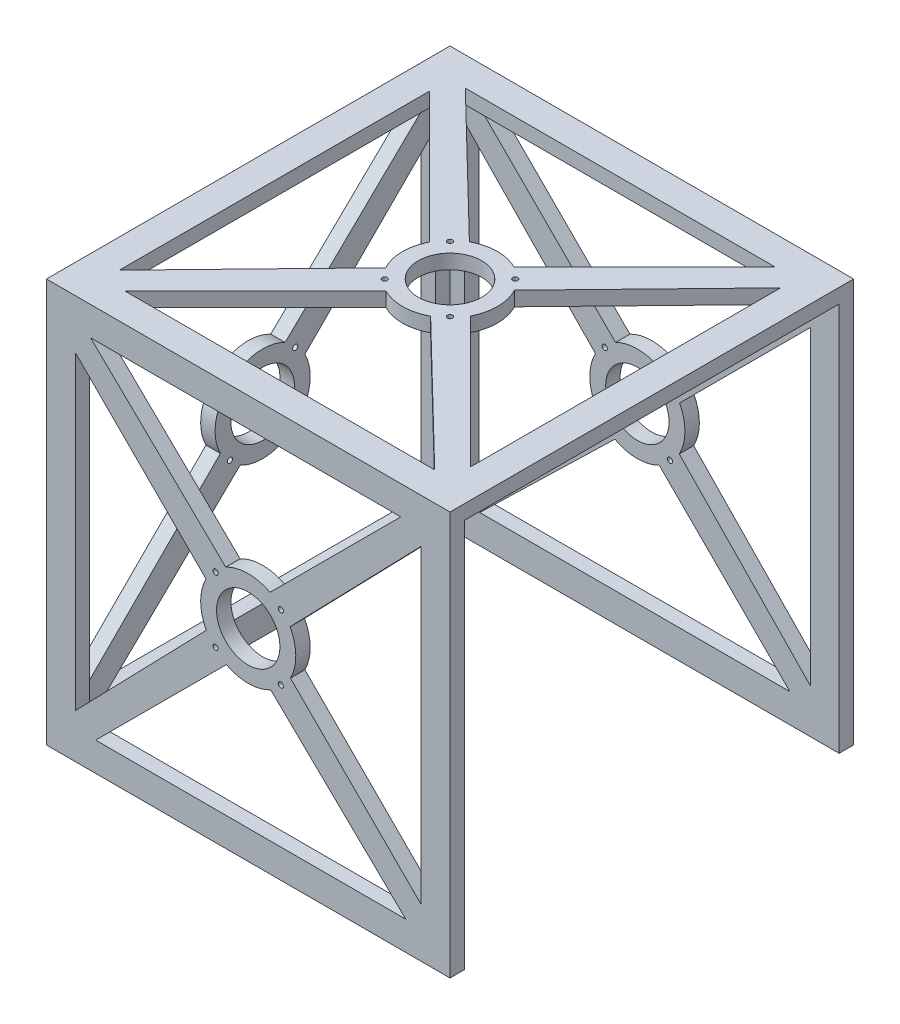
from build123d import *

# Parameters (mm, degrees)
SKETCH3_W                 = 140
SKETCH3_H                 = 140
BOSS_EXTRUDE1_DEPTH       = 5
CUT_EXTRUDE1_DEPTH        = 5
CIRPATTERN1_COUNT         = 4
CUT_EXTRUDE2_REACH        = 101.121
SKETCH7_R                 = 11
CIRPATTERN2_COUNT         = 4
CIRPATTERN3_START         = -70
CIRPATTERN3_OUTLINE_W     = 140
CIRPATTERN3_OUTLINE_H     = 140
CIRPATTERN3_OUTLINE_R     = 0.9
CIRPATTERN3_OUTLINE_R_2   = 11
CIRPATTERN3_DEPTH         = 5
CIRPATTERN3_START_2       = -135
CIRPATTERN3_2_OUTLINE_W   = 140
CIRPATTERN3_2_OUTLINE_H   = 140
CIRPATTERN3_2_OUTLINE_R   = 0.9
CIRPATTERN3_2_OUTLINE_R_2 = 11
CIRPATTERN3_2_DEPTH       = 5
CIRPATTERN4_START         = 65
CIRPATTERN4_OUTLINE_W     = 140
CIRPATTERN4_OUTLINE_H     = 140
CIRPATTERN4_OUTLINE_R     = 0.9
CIRPATTERN4_OUTLINE_R_2   = 11
CIRPATTERN4_DEPTH         = 5


# Read off the part's stored shape, not the designer's step: CirPattern3, CirPattern4
with BuildPart() as part:
    # Sketch3 → Boss-Extrude1 (new body)
    with BuildSketch(Plane.XY):
        Rectangle(SKETCH3_W, SKETCH3_H)
    extrude(amount=BOSS_EXTRUDE1_DEPTH)

    # Sketch4 → Cut-Extrude1 (cut)
    with BuildSketch(Plane.XY.offset(5)):
        with BuildLine():
            Line((7.583144073, 14.654211885), (52.928932188, 60))
            Line((52.928932188, 60), (-54.688394727, 60))
            Line((-54.688394727, 60), (-7.80758307, 14.53587447))
            ThreePointArc((-7.80758307, 14.53587447), (-0.126862728, 16.499512291), (7.583144073, 14.654211885))
        make_face()
    cut_extrude1 = extrude(amount=-CUT_EXTRUDE1_DEPTH, mode=Mode.SUBTRACT)

    # CirPattern1: Cut-Extrude1 ×4 about axis
    cirpattern1_axis = Axis((0, 0, 0), (0, 0, 1))
    for i in range(1, CIRPATTERN1_COUNT):
        add(cut_extrude1.rotate(cirpattern1_axis, i * 360 / CIRPATTERN1_COUNT), mode=Mode.SUBTRACT)

    # Sketch7 → Cut-Extrude2 (cut, up to next)
    with BuildSketch(Plane.XY.offset(5), mode=Mode.PRIVATE) as cut_extrude2_sk1:
        Circle(SKETCH7_R)
    cut_extrude2_tool1 = extrude(cut_extrude2_sk1.sketch, amount=-CUT_EXTRUDE2_REACH, mode=Mode.PRIVATE) & part.part
    add(cut_extrude2_tool1.solids().sort_by_distance((0, 0, 5))[0], mode=Mode.SUBTRACT)

    # Sketch9 → Ø1.8 (1.8) Diameter Hole1 (revolve, cut)
    with BuildSketch(Plane(origin=(11.313708499, -11.313708499, 5), x_dir=(0, -1, 0), z_dir=(1, 0, 0))):
        Polygon((0, 0), (0, 6.540774557), (0.9, 6), (0.9, 0), align=None)
    f_1_8_1_8_diameter_hole1 = revolve(axis=Axis((11.313708499, -11.313708499, 11.35), (0, 0, -1)), mode=Mode.SUBTRACT)

    # CirPattern2: Ø1.8 (1.8) Diameter Hole1 ×4 about axis
    cirpattern2_axis = Axis((0, 0, 0), (0, 0, 1))
    for i in range(1, CIRPATTERN2_COUNT):
        add(f_1_8_1_8_diameter_hole1.rotate(cirpattern2_axis, i * 360 / CIRPATTERN2_COUNT), mode=Mode.SUBTRACT)


with BuildPart() as body_2:
    # CirPattern3 outline → CirPattern3 (new body)
    with BuildSketch(Plane.YZ.offset(CIRPATTERN3_START)):
        with Locations((0, -65)):
            Rectangle(CIRPATTERN3_OUTLINE_W, CIRPATTERN3_OUTLINE_H)
        with BuildLine():
            ThreePointArc((-7.80758307, -79.53587447), (-0.126862728, -81.499512291), (7.583144073, -79.654211885))
            Line((7.583144073, -79.654211885), (52.928932188, -125))
            Line((52.928932188, -125), (-54.688394727, -125))
            Line((-54.688394727, -125), (-7.80758307, -79.53587447))
        make_face(mode=Mode.SUBTRACT)
        with Locations((-11.313708499, -76.313708499)):
            Circle(CIRPATTERN3_OUTLINE_R, mode=Mode.SUBTRACT)
        with Locations((11.313708499, -76.313708499)):
            Circle(CIRPATTERN3_OUTLINE_R, mode=Mode.SUBTRACT)
        with BuildLine():
            Line((60, -12.071067812), (60, -119.688394727))
            Line((60, -119.688394727), (14.53587447, -72.80758307))
            ThreePointArc((14.53587447, -72.80758307), (16.499512291, -65.126862728), (14.654211885, -57.416855927))
            Line((14.654211885, -57.416855927), (60, -12.071067812))
        make_face(mode=Mode.SUBTRACT)
        with BuildLine():
            ThreePointArc((-14.53587447, -57.19241693), (-16.499512291, -64.873137272), (-14.654211885, -72.583144073))
            Line((-14.654211885, -72.583144073), (-60, -117.928932188))
            Line((-60, -117.928932188), (-60, -10.311605273))
            Line((-60, -10.311605273), (-14.53587447, -57.19241693))
        make_face(mode=Mode.SUBTRACT)
        with Locations((-11.313708499, -53.686291501)):
            Circle(CIRPATTERN3_OUTLINE_R, mode=Mode.SUBTRACT)
        with Locations((0, -65)):
            Circle(CIRPATTERN3_OUTLINE_R_2, mode=Mode.SUBTRACT)
        with Locations((11.313708499, -53.686291501)):
            Circle(CIRPATTERN3_OUTLINE_R, mode=Mode.SUBTRACT)
        with BuildLine():
            ThreePointArc((7.80758307, -50.46412553), (0.126862728, -48.500487709), (-7.583144073, -50.345788115))
            Line((-7.583144073, -50.345788115), (-52.928932188, -5))
            Line((-52.928932188, -5), (54.688394727, -5))
            Line((54.688394727, -5), (7.80758307, -50.46412553))
        make_face(mode=Mode.SUBTRACT)
    extrude(amount=CIRPATTERN3_DEPTH)


with BuildPart() as body_3:
    # CirPattern3 2 outline → CirPattern3 2 (new body)
    with BuildSketch(Plane.XY.offset(CIRPATTERN3_START_2)):
        Rectangle(CIRPATTERN3_2_OUTLINE_W, CIRPATTERN3_2_OUTLINE_H)
        with BuildLine():
            Line((52.928932188, -60), (-54.688394727, -60))
            Line((-54.688394727, -60), (-7.80758307, -14.53587447))
            ThreePointArc((-7.80758307, -14.53587447), (-0.126862728, -16.499512291), (7.583144073, -14.654211885))
            Line((7.583144073, -14.654211885), (52.928932188, -60))
        make_face(mode=Mode.SUBTRACT)
        with Locations((-11.313708499, -11.313708499)):
            Circle(CIRPATTERN3_2_OUTLINE_R, mode=Mode.SUBTRACT)
        with Locations((11.313708499, -11.313708499)):
            Circle(CIRPATTERN3_2_OUTLINE_R, mode=Mode.SUBTRACT)
        with BuildLine():
            ThreePointArc((14.53587447, -7.80758307), (16.499512291, -0.126862728), (14.654211885, 7.583144073))
            Line((14.654211885, 7.583144073), (60, 52.928932188))
            Line((60, 52.928932188), (60, -54.688394727))
            Line((60, -54.688394727), (14.53587447, -7.80758307))
        make_face(mode=Mode.SUBTRACT)
        with BuildLine():
            ThreePointArc((-14.53587447, 7.80758307), (-16.499512291, 0.126862728), (-14.654211885, -7.583144073))
            Line((-14.654211885, -7.583144073), (-60, -52.928932188))
            Line((-60, -52.928932188), (-60, 54.688394727))
            Line((-60, 54.688394727), (-14.53587447, 7.80758307))
        make_face(mode=Mode.SUBTRACT)
        with Locations((-11.313708499, 11.313708499)):
            Circle(CIRPATTERN3_2_OUTLINE_R, mode=Mode.SUBTRACT)
        Circle(CIRPATTERN3_2_OUTLINE_R_2, mode=Mode.SUBTRACT)
        with Locations((11.313708499, 11.313708499)):
            Circle(CIRPATTERN3_2_OUTLINE_R, mode=Mode.SUBTRACT)
        with BuildLine():
            Line((-52.928932188, 60), (54.688394727, 60))
            Line((54.688394727, 60), (7.80758307, 14.53587447))
            ThreePointArc((7.80758307, 14.53587447), (0.126862728, 16.499512291), (-7.583144073, 14.654211885))
            Line((-7.583144073, 14.654211885), (-52.928932188, 60))
        make_face(mode=Mode.SUBTRACT)
    extrude(amount=CIRPATTERN3_2_DEPTH)


with BuildPart() as body_4:
    # CirPattern4 outline → CirPattern4 (new body)
    with BuildSketch(Plane(origin=(0, 0, 0), x_dir=(1, 0, 0), z_dir=(0, 1, 0)).offset(CIRPATTERN4_START)):
        with Locations((0, 65)):
            Rectangle(CIRPATTERN4_OUTLINE_W, CIRPATTERN4_OUTLINE_H)
        with BuildLine():
            Line((-60, 10.311605273), (-60, 117.928932188))
            Line((-60, 117.928932188), (-14.654211885, 72.583144073))
            ThreePointArc((-14.654211885, 72.583144073), (-16.499512291, 64.873137272), (-14.53587447, 57.19241693))
            Line((-14.53587447, 57.19241693), (-60, 10.311605273))
        make_face(mode=Mode.SUBTRACT)
        with Locations((-11.313708499, 53.686291501)):
            Circle(CIRPATTERN4_OUTLINE_R, mode=Mode.SUBTRACT)
        with BuildLine():
            Line((54.688394727, 5), (-52.928932188, 5))
            Line((-52.928932188, 5), (-7.583144073, 50.345788115))
            ThreePointArc((-7.583144073, 50.345788115), (0.126862728, 48.500487709), (7.80758307, 50.46412553))
            Line((7.80758307, 50.46412553), (54.688394727, 5))
        make_face(mode=Mode.SUBTRACT)
        with Locations((11.313708499, 53.686291501)):
            Circle(CIRPATTERN4_OUTLINE_R, mode=Mode.SUBTRACT)
        with Locations((-11.313708499, 76.313708499)):
            Circle(CIRPATTERN4_OUTLINE_R, mode=Mode.SUBTRACT)
        with BuildLine():
            Line((-54.688394727, 125), (52.928932188, 125))
            Line((52.928932188, 125), (7.583144073, 79.654211885))
            ThreePointArc((7.583144073, 79.654211885), (-0.126862728, 81.499512291), (-7.80758307, 79.53587447))
            Line((-7.80758307, 79.53587447), (-54.688394727, 125))
        make_face(mode=Mode.SUBTRACT)
        with Locations((0, 65)):
            Circle(CIRPATTERN4_OUTLINE_R_2, mode=Mode.SUBTRACT)
        with Locations((11.313708499, 76.313708499)):
            Circle(CIRPATTERN4_OUTLINE_R, mode=Mode.SUBTRACT)
        with BuildLine():
            Line((60, 119.688394727), (60, 12.071067812))
            Line((60, 12.071067812), (14.654211885, 57.416855927))
            ThreePointArc((14.654211885, 57.416855927), (16.499512291, 65.126862728), (14.53587447, 72.80758307))
            Line((14.53587447, 72.80758307), (60, 119.688394727))
        make_face(mode=Mode.SUBTRACT)
    extrude(amount=CIRPATTERN4_DEPTH)


with BuildPart() as part_1:
    add(part.part)

    # Combine1: union body 4, body 3, body 2
    add(body_4.part)
    add(body_3.part)
    add(body_2.part)


solid = part_1.part
